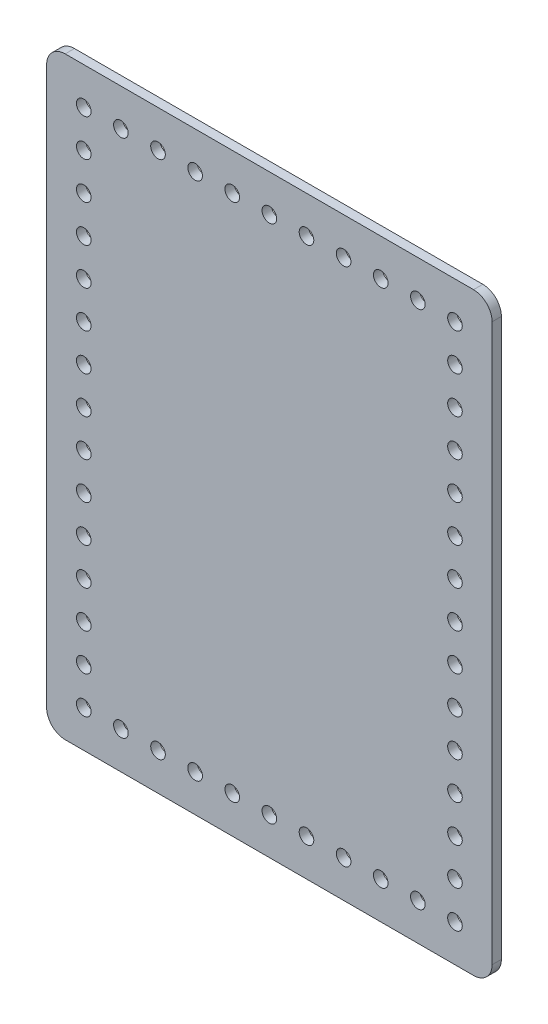
from build123d import *

# Parameters (mm, degrees)
BOSS_EXTRUDE1_DEPTH = 3.175
SKETCH3_R           = 2.5
CUT_EXTRUDE2_DEPTH  = 460.246629045


with BuildPart() as part:
    # Sketch1 → Boss-Extrude1 (new body)
    with BuildSketch(Plane.XY):
        with BuildLine():
            Line((-367.50625, 266.7), (-227.80625, 266.7))
            ThreePointArc((-227.80625, 266.7), (-223.316121939, 264.840128061), (-221.45625, 260.35))
            Line((-221.45625, 260.35), (-221.45625, 69.85))
            ThreePointArc((-221.45625, 69.85), (-223.316121939, 65.359871939), (-227.80625, 63.5))
            Line((-227.80625, 63.5), (-367.50625, 63.5))
            ThreePointArc((-367.50625, 63.5), (-371.996378061, 65.359871939), (-373.85625, 69.85))
            Line((-373.85625, 69.85), (-373.85625, 260.35))
            ThreePointArc((-373.85625, 260.35), (-371.996378061, 264.840128061), (-367.50625, 266.7))
        make_face()
    extrude(amount=BOSS_EXTRUDE1_DEPTH)

    # Sketch3 → Cut-Extrude2 (cut, through all)
    with BuildSketch(Plane.XY.offset(3.175)):
        with Locations((-234.15625, 254)):
            Circle(SKETCH3_R)
        with Locations((-361.15625, 254)):
            Circle(SKETCH3_R)
        with Locations((-361.15625, 241.3)):
            Circle(SKETCH3_R)
        with Locations((-234.15625, 241.3)):
            Circle(SKETCH3_R)
        with Locations((-361.15625, 228.6)):
            Circle(SKETCH3_R)
        with Locations((-234.15625, 228.6)):
            Circle(SKETCH3_R)
        with Locations((-361.15625, 215.9)):
            Circle(SKETCH3_R)
        with Locations((-234.15625, 215.9)):
            Circle(SKETCH3_R)
        with Locations((-361.15625, 203.2)):
            Circle(SKETCH3_R)
        with Locations((-234.15625, 203.2)):
            Circle(SKETCH3_R)
        with Locations((-361.15625, 190.5)):
            Circle(SKETCH3_R)
        with Locations((-234.15625, 190.5)):
            Circle(SKETCH3_R)
        with Locations((-361.15625, 177.8)):
            Circle(SKETCH3_R)
        with Locations((-234.15625, 177.8)):
            Circle(SKETCH3_R)
        with Locations((-361.15625, 165.1)):
            Circle(SKETCH3_R)
        with Locations((-234.15625, 165.1)):
            Circle(SKETCH3_R)
        with Locations((-361.15625, 152.4)):
            Circle(SKETCH3_R)
        with Locations((-234.15625, 152.4)):
            Circle(SKETCH3_R)
        with Locations((-361.15625, 139.7)):
            Circle(SKETCH3_R)
        with Locations((-234.15625, 139.7)):
            Circle(SKETCH3_R)
        with Locations((-361.15625, 127)):
            Circle(SKETCH3_R)
        with Locations((-234.15625, 127)):
            Circle(SKETCH3_R)
        with Locations((-361.15625, 114.3)):
            Circle(SKETCH3_R)
        with Locations((-234.15625, 114.3)):
            Circle(SKETCH3_R)
        with Locations((-361.15625, 101.6)):
            Circle(SKETCH3_R)
        with Locations((-234.15625, 101.6)):
            Circle(SKETCH3_R)
        with Locations((-361.15625, 88.9)):
            Circle(SKETCH3_R)
        with Locations((-234.15625, 88.9)):
            Circle(SKETCH3_R)
        with Locations((-361.15625, 76.2)):
            Circle(SKETCH3_R)
        with Locations((-234.15625, 76.2)):
            Circle(SKETCH3_R)
        with Locations((-348.45625, 254)):
            Circle(SKETCH3_R)
        with Locations((-348.45625, 76.2)):
            Circle(SKETCH3_R)
        with Locations((-335.75625, 254)):
            Circle(SKETCH3_R)
        with Locations((-335.75625, 76.2)):
            Circle(SKETCH3_R)
        with Locations((-323.05625, 254)):
            Circle(SKETCH3_R)
        with Locations((-323.05625, 76.2)):
            Circle(SKETCH3_R)
        with Locations((-310.35625, 254)):
            Circle(SKETCH3_R)
        with Locations((-310.35625, 76.2)):
            Circle(SKETCH3_R)
        with Locations((-297.65625, 254)):
            Circle(SKETCH3_R)
        with Locations((-297.65625, 76.2)):
            Circle(SKETCH3_R)
        with Locations((-284.95625, 254)):
            Circle(SKETCH3_R)
        with Locations((-284.95625, 76.2)):
            Circle(SKETCH3_R)
        with Locations((-272.25625, 254)):
            Circle(SKETCH3_R)
        with Locations((-272.25625, 76.2)):
            Circle(SKETCH3_R)
        with Locations((-259.55625, 254)):
            Circle(SKETCH3_R)
        with Locations((-259.55625, 76.2)):
            Circle(SKETCH3_R)
        with Locations((-246.85625, 254)):
            Circle(SKETCH3_R)
        with Locations((-246.85625, 76.2)):
            Circle(SKETCH3_R)
    extrude(amount=-CUT_EXTRUDE2_DEPTH, mode=Mode.SUBTRACT)


solid = part.part
